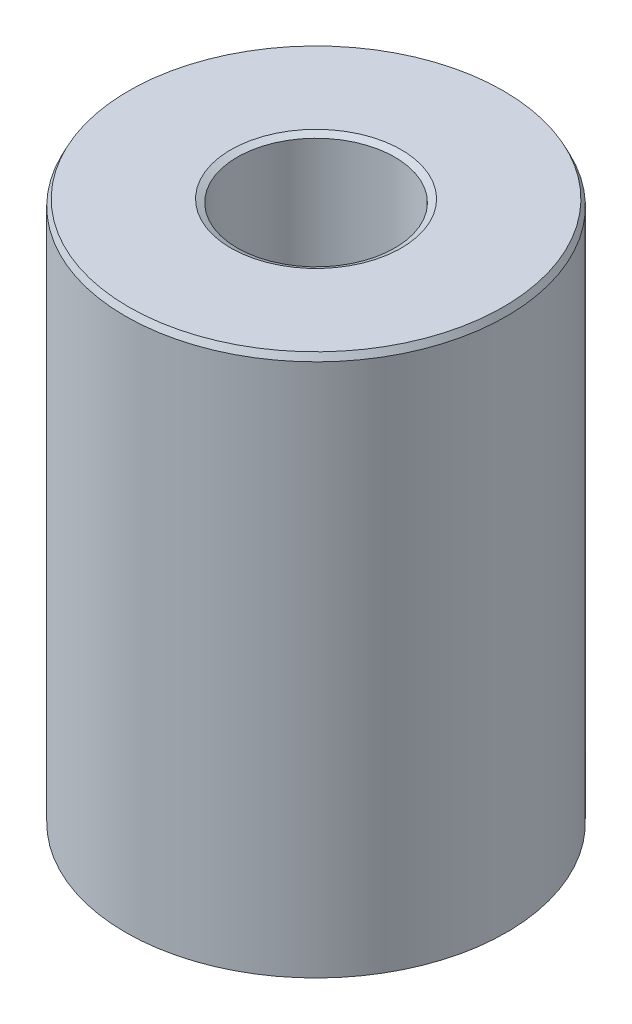
from build123d import *
from OCP.BRepFilletAPI import BRepFilletAPI_MakeChamfer

# Parameters (mm, degrees)
SKETCH1_R           = 35
BOSS_EXTRUDE1_DEPTH = 99.829936474
SKETCH2_R           = 14.477135886
CUT_EXTRUDE1_DEPTH  = 112.427178985
CHAMFER1_SIZE       = 1.188111142
CHAMFER1_SIZE2      = 0.58074138


with BuildPart() as part:
    # Sketch1 → Boss-Extrude1 (new body)
    with BuildSketch(Plane(origin=(0, 0, 0), x_dir=(1, 0, 0), z_dir=(0, 1, 0))):
        Circle(SKETCH1_R)
    extrude(amount=BOSS_EXTRUDE1_DEPTH)

    # Sketch2 → Cut-Extrude1 (cut, through all)
    with BuildSketch(Plane(origin=(0, 0, 0), x_dir=(1, 0, 0), z_dir=(0, 1, 0))):
        Circle(SKETCH2_R)
    extrude(amount=CUT_EXTRUDE1_DEPTH, mode=Mode.SUBTRACT)

    # Chamfer1: one chamfer whose edges measure the first distance from different faces: ONE call of the kernel's chamfer builder (chamfer() names one face for all edges)
    chamfer1_edges_1 = [part.edges().sort_by_distance(p)[0] for p in [
        (-14.477135886, 99.829936474, 0),
    ]]
    chamfer1_side_1 = [part.faces().sort_by_distance(p)[0] for p in [
        (-34.010050506, 99.829936474, 0),
    ]]
    chamfer1_edges_2 = [part.edges().sort_by_distance(p)[0] for p in [
        (-14.477135886, 0, 0),
    ]]
    chamfer1_side_2 = [part.faces().sort_by_distance(p)[0] for p in [
        (-14.477135886, 49.914968237, 0),
    ]]
    chamfer1_edges_3 = [part.edges().sort_by_distance(p)[0] for p in [
        (-35, 0, 0),
    ]]
    chamfer1_side_3 = [part.faces().sort_by_distance(p)[0] for p in [
        (-34.010050506, 0, 0),
    ]]
    chamfer1_edges_4 = [part.edges().sort_by_distance(p)[0] for p in [
        (-35, 99.829936474, 0),
    ]]
    chamfer1_side_4 = [part.faces().sort_by_distance(p)[0] for p in [
        (-35, 49.914968237, 0),
    ]]
    chamfer1 = BRepFilletAPI_MakeChamfer(part.part.solid().wrapped)
    for e in chamfer1_edges_1:
        chamfer1.Add(CHAMFER1_SIZE, CHAMFER1_SIZE2, e.wrapped, chamfer1_side_1[0].wrapped)  # the first distance lies on this face
    for e in chamfer1_edges_2:
        chamfer1.Add(CHAMFER1_SIZE, CHAMFER1_SIZE2, e.wrapped, chamfer1_side_2[0].wrapped)  # the first distance lies on this face
    for e in chamfer1_edges_3:
        chamfer1.Add(CHAMFER1_SIZE, CHAMFER1_SIZE2, e.wrapped, chamfer1_side_3[0].wrapped)  # the first distance lies on this face
    for e in chamfer1_edges_4:
        chamfer1.Add(CHAMFER1_SIZE, CHAMFER1_SIZE2, e.wrapped, chamfer1_side_4[0].wrapped)  # the first distance lies on this face
    add(Compound.cast(chamfer1.Shape()), mode=Mode.REPLACE)


solid = part.part
